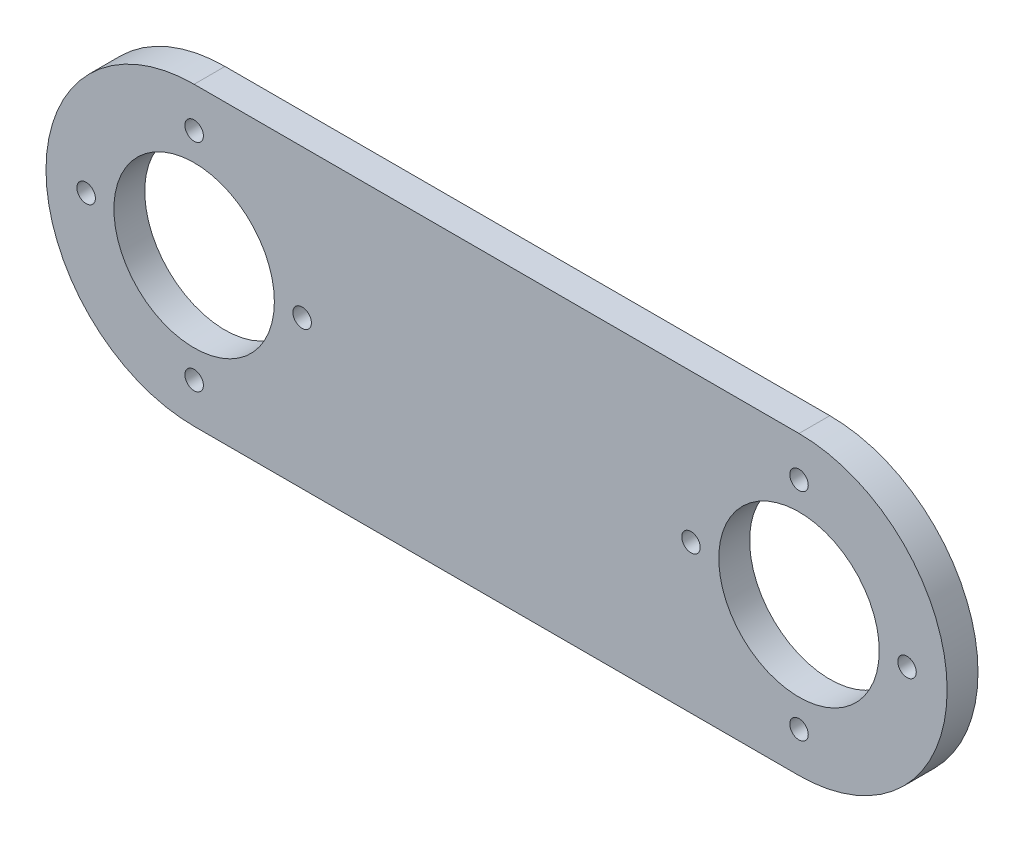
from build123d import *

# Parameters (mm, degrees)
SKETCH1_R           = 1.5
SKETCH1_R_2         = 13
BOSS_EXTRUDE1_DEPTH = 5


with BuildPart() as part:
    # Sketch1 → Boss-Extrude1 (new body)
    with BuildSketch(Plane.XY):
        with BuildLine():
            Line((-49, 29), (49, 29))
            ThreePointArc((49, 29), (73, 5), (49, -19))
            Line((49, -19), (-49, -19))
            ThreePointArc((-49, -19), (-73, 5), (-49, 29))
        make_face()
        with Locations((49, -12.5)):
            Circle(SKETCH1_R, mode=Mode.SUBTRACT)
        with Locations((66.5, 5)):
            Circle(SKETCH1_R, mode=Mode.SUBTRACT)
        with Locations((31.5, 5)):
            Circle(SKETCH1_R, mode=Mode.SUBTRACT)
        with Locations((49, 22.5)):
            Circle(SKETCH1_R, mode=Mode.SUBTRACT)
        with Locations((-49, -12.5)):
            Circle(SKETCH1_R, mode=Mode.SUBTRACT)
        with Locations((-31.5, 5)):
            Circle(SKETCH1_R, mode=Mode.SUBTRACT)
        with Locations((-66.5, 5)):
            Circle(SKETCH1_R, mode=Mode.SUBTRACT)
        with Locations((-49, 22.5)):
            Circle(SKETCH1_R, mode=Mode.SUBTRACT)
        with Locations((-49, 5)):
            Circle(SKETCH1_R_2, mode=Mode.SUBTRACT)
        with Locations((49, 5)):
            Circle(SKETCH1_R_2, mode=Mode.SUBTRACT)
    extrude(amount=BOSS_EXTRUDE1_DEPTH)


solid = part.part
